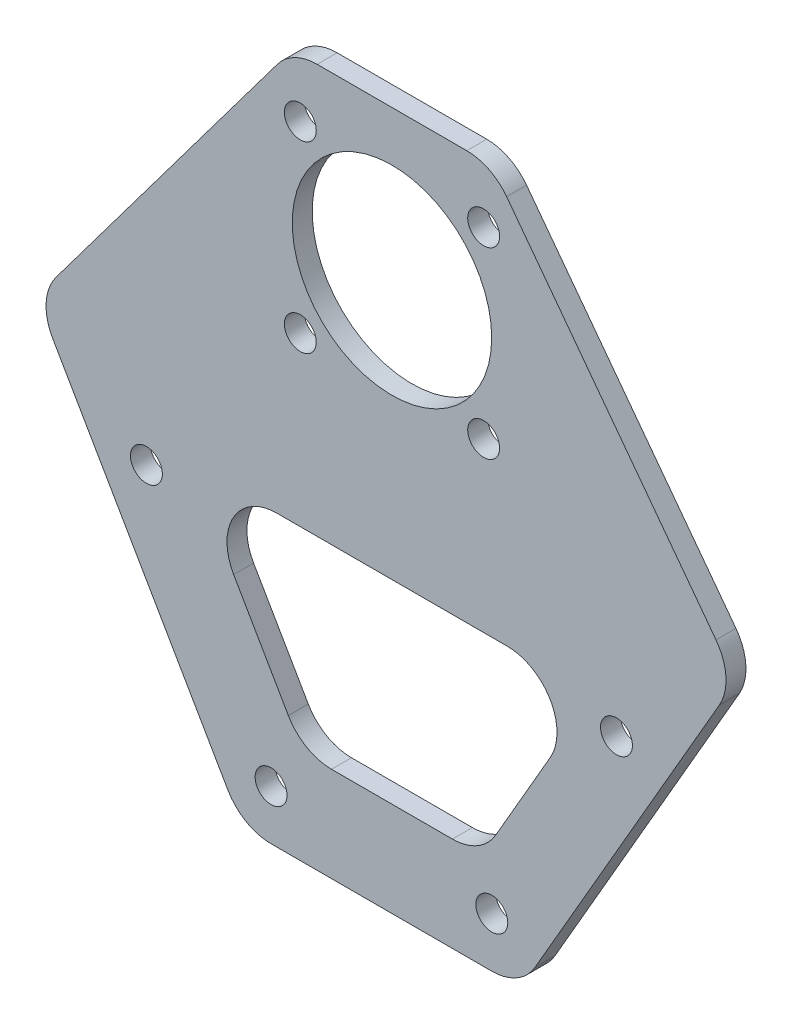
from build123d import *

# Parameters (mm, degrees)
EXTRUDE_1_OUTLINE_R   = 1.6
EXTRUDE_1_OUTLINE_R_2 = 10
EXTRUDE_1_DEPTH       = 2
FILLET_1_R            = 5


# Read off the part's stored shape, not the designer's step: ﾎﾞｽ - 押し出し1
with BuildPart() as part:
    # ﾎﾞｽ - 押し出し1 outline → ﾎﾞｽ - 押し出し1 (new body)
    with BuildSketch(Plane.XY):
        Polygon((-15.011106999, -35), (12.897858345, -35), (34.473029949, 2.369293401), (10, 35), (-10, 35), (-35.667090423, 0.77721277), align=None)
        with Locations((-12.124355653, -30)):
            Circle(EXTRUDE_1_OUTLINE_R, mode=Mode.SUBTRACT)
        with Locations((-24.624355653, -8.349364905)):
            Circle(EXTRUDE_1_OUTLINE_R, mode=Mode.SUBTRACT)
        with Locations((10.011106999, -30)):
            Circle(EXTRUDE_1_OUTLINE_R, mode=Mode.SUBTRACT)
        with BuildLine():
            Line((6.062177826, -25.5), (-6.062177826, -25.5))
            ThreePointArc((-6.062177826, -25.5), (-8.562177826, -24.830127019), (-10.392304845, -23))
            Line((-10.392304845, -23), (-15.877132403, -13.5))
            ThreePointArc((-15.877132403, -13.5), (-15.877132403, -8.5), (-11.547005384, -6))
            Line((-11.547005384, -6), (11.547005384, -6))
            ThreePointArc((11.547005384, -6), (15.877132403, -8.5), (15.877132403, -13.5))
            Line((15.877132403, -13.5), (10.392304845, -23))
            ThreePointArc((10.392304845, -23), (8.562177826, -24.830127019), (6.062177826, -25.5))
        make_face(mode=Mode.SUBTRACT)
        with Locations((22.511106999, -8.349364905)):
            Circle(EXTRUDE_1_OUTLINE_R, mode=Mode.SUBTRACT)
        with Locations((-9.192388155, 10.807611845)):
            Circle(EXTRUDE_1_OUTLINE_R, mode=Mode.SUBTRACT)
        with Locations((-9.192388155, 29.192388155)):
            Circle(EXTRUDE_1_OUTLINE_R, mode=Mode.SUBTRACT)
        with Locations((9.192388155, 10.807611845)):
            Circle(EXTRUDE_1_OUTLINE_R, mode=Mode.SUBTRACT)
        with Locations((0, 20)):
            Circle(EXTRUDE_1_OUTLINE_R_2, mode=Mode.SUBTRACT)
        with Locations((9.192388155, 29.192388155)):
            Circle(EXTRUDE_1_OUTLINE_R, mode=Mode.SUBTRACT)
    extrude(amount=EXTRUDE_1_DEPTH)

    # ﾌｨﾚｯﾄ1
    fillet_1_edges = [part.edges().sort_by_distance(p)[0] for p in [
        (12.897858345, -35, 1),
        (-15.011106999, -35, 1),
        (-35.667090423, 0.77721277, 1),
        (-10, 35, 1),
        (10, 35, 1),
        (34.473029949, 2.369293401, 1),
    ]]
    fillet(fillet_1_edges, radius=FILLET_1_R)


solid = part.part
